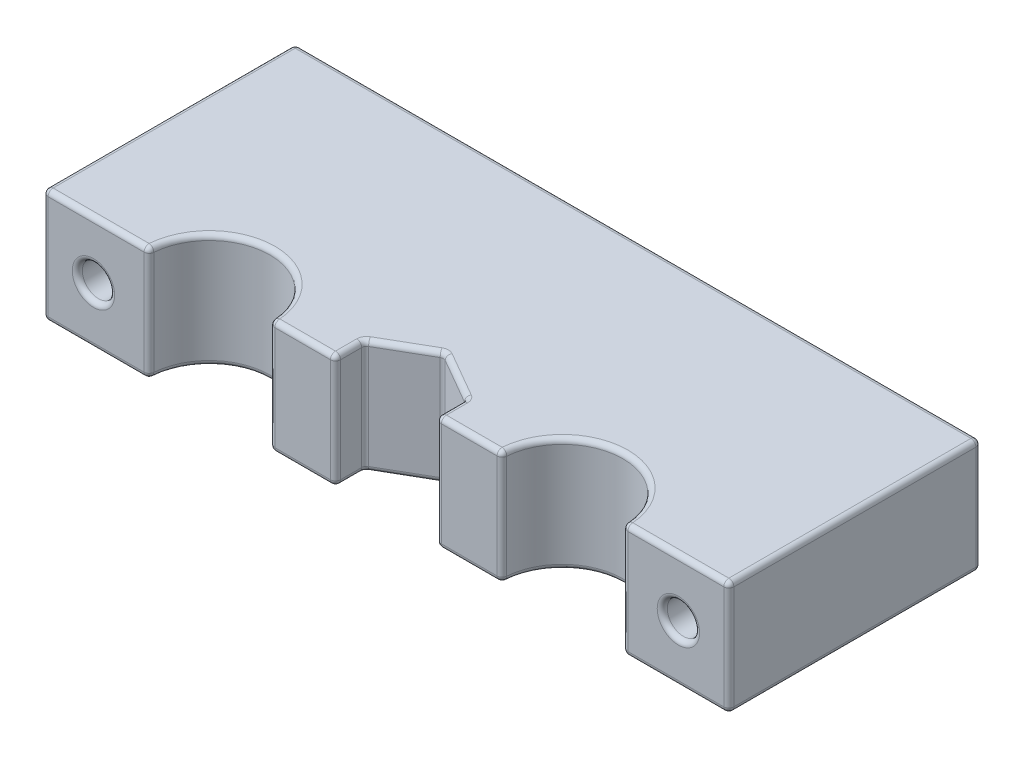
from build123d import *

# Parameters (mm, degrees)
BOSS_EXTRUDE1_DEPTH = 11.3
SKETCH2_R           = 1.6
CUT_EXTRUDE1_DEPTH  = 74.325916292
FILLET1_R           = 0.5


with BuildPart() as part:
    # Sketch1 → Boss-Extrude1 (new body)
    with BuildSketch(Plane(origin=(0, 0, 0), x_dir=(1, 0, 0), z_dir=(0, 1, 0))):
        with BuildLine():
            Line((57.5, 0), (68, 0))
            Line((68, 0), (68, 25))
            Line((68, 25), (0, 25))
            Line((0, 25), (0, 0))
            Line((0, 0), (10.5, 0))
            ThreePointArc((10.5, 0), (16.5, 6), (22.5, 0))
            Line((22.5, 0), (29, 0))
            Line((29, 0), (29, 2.886751346))
            Line((29, 2.886751346), (34, 5.773502692))
            Line((34, 5.773502692), (39, 2.886751346))
            Line((39, 2.886751346), (39, 0))
            Line((39, 0), (45.5, 0))
            ThreePointArc((45.5, 0), (51.5, 6), (57.5, 0))
        make_face()
    extrude(amount=BOSS_EXTRUDE1_DEPTH)

    # Sketch2 → Cut-Extrude1 (cut, through all)
    with BuildSketch(Plane(origin=(0, 0, -25), x_dir=(-1, 0, 0), z_dir=(0, 0, -1))):
        with Locations((-5, 5.65)):
            Circle(SKETCH2_R)
        with Locations((-63, 5.65)):
            Circle(SKETCH2_R)
    extrude(amount=-CUT_EXTRUDE1_DEPTH, mode=Mode.SUBTRACT)

    # Fillet1
    fillet1_edges = [part.edges().sort_by_distance(p)[0] for p in [
        (29, 5.65, 0),
        (29, 5.65, -2.886751346),
        (34, 5.65, -5.773502692),
        (39, 5.65, -2.886751346),
        (64.6, 5.65, 0),
        (6.6, 5.65, 0),
        (10.5, 5.65, 0),
        (22.5, 5.65, 0),
        (45.5, 5.65, 0),
        (57.5, 5.65, 0),
        (68, 5.65, 0),
        (0, 5.65, 0),
        (68, 5.65, -25),
        (0, 5.65, -25),
        (64.6, 5.65, -25),
        (6.6, 5.65, -25),
        (16.5, 0, -6),
        (25.75, 0, 0),
        (29, 0, -1.443375673),
        (31.5, 0, -4.330127019),
        (36.5, 0, -4.330127019),
        (39, 0, -1.443375673),
        (42.25, 0, 0),
        (51.5, 0, -6),
        (62.75, 0, 0),
        (68, 0, -12.5),
        (34, 0, -25),
        (0, 0, -12.5),
        (5.25, 0, 0),
        (0, 11.3, -12.5),
        (34, 11.3, -25),
        (68, 11.3, -12.5),
        (62.75, 11.3, 0),
        (51.5, 11.3, -6),
        (42.25, 11.3, 0),
        (39, 11.3, -1.443375673),
        (36.5, 11.3, -4.330127019),
        (31.5, 11.3, -4.330127019),
        (29, 11.3, -1.443375673),
        (25.75, 11.3, 0),
        (16.5, 11.3, -6),
        (5.25, 11.3, 0),
        (39, 5.65, 0),
    ]]
    fillet(fillet1_edges, radius=FILLET1_R)


solid = part.part
